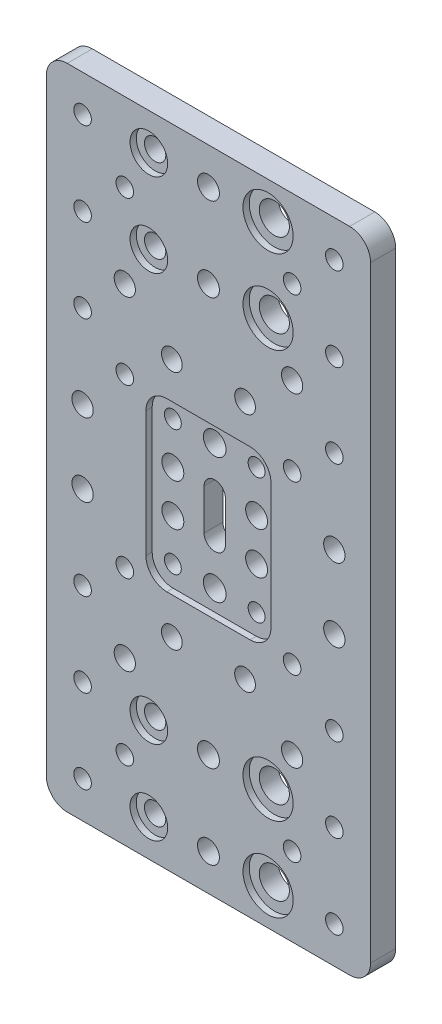
from build123d import *

# Parameters (mm, degrees)
BOSS_EXTRUDE1_OUTLINE_R    = 2.55
BOSS_EXTRUDE1_OUTLINE_R_2  = 2.621431339
BOSS_EXTRUDE1_OUTLINE_R_3  = 2.017902989
BOSS_EXTRUDE1_OUTLINE_R_4  = 2.1
BOSS_EXTRUDE1_OUTLINE_R_5  = 2.538142432
BOSS_EXTRUDE1_OUTLINE_R_6  = 2.478866387
BOSS_EXTRUDE1_OUTLINE_R_7  = 2.709196321
BOSS_EXTRUDE1_OUTLINE_R_8  = 2.625839509
BOSS_EXTRUDE1_OUTLINE_R_9  = 3.6
BOSS_EXTRUDE1_OUTLINE_R_10 = 2.614760952
BOSS_EXTRUDE1_DEPTH        = 6
SKETCH2_R                  = 6
SKETCH2_R_2                = 4.5
CUT_EXTRUDE1_DEPTH         = 1.5


# Read off the part's stored shape, not the designer's step: Boss-Extrude1
with BuildPart() as part:
    # Boss-Extrude1 outline → Boss-Extrude1 (new body)
    with BuildSketch(Plane.XY):
        with BuildLine():
            Line((-2.55, 0), (-2.55, 4.870526086))
            ThreePointArc((-2.55, 4.870526086), (0, 7.420526086), (2.55, 4.870526086))
            Line((2.55, 4.870526086), (2.55, 0))
            Line((2.55, 0), (38.76, 0))
            Line((38.76, 0), (38.76, 72.51))
            ThreePointArc((38.76, 72.51), (37.295533906, 76.045533906), (33.76, 77.51))
            Line((33.76, 77.51), (-33.76, 77.51))
            ThreePointArc((-33.76, 77.51), (-37.295533906, 76.045533906), (-38.76, 72.51))
            Line((-38.76, 72.51), (-38.76, 0))
            Line((-38.76, 0), (-2.55, 0))
        make_face()
        with Locations((-30.09, 8.75)):
            Circle(BOSS_EXTRUDE1_OUTLINE_R, mode=Mode.SUBTRACT)
        with Locations((-10.01, 5.02)):
            Circle(BOSS_EXTRUDE1_OUTLINE_R_2, mode=Mode.SUBTRACT)
        with Locations((-10.01, 15.02)):
            Circle(BOSS_EXTRUDE1_OUTLINE_R_3, mode=Mode.SUBTRACT)
        with Locations((-30.09, 28.75)):
            Circle(BOSS_EXTRUDE1_OUTLINE_R_4, mode=Mode.SUBTRACT)
        with Locations((-20, 20)):
            Circle(BOSS_EXTRUDE1_OUTLINE_R_4, mode=Mode.SUBTRACT)
        with Locations((-20, 38.75)):
            Circle(BOSS_EXTRUDE1_OUTLINE_R_5, mode=Mode.SUBTRACT)
        with Locations((-8.75, 28.75)):
            Circle(BOSS_EXTRUDE1_OUTLINE_R_6, mode=Mode.SUBTRACT)
        with Locations((10.01, 5.02)):
            Circle(BOSS_EXTRUDE1_OUTLINE_R_2, mode=Mode.SUBTRACT)
        with Locations((0, 15.02)):
            Circle(BOSS_EXTRUDE1_OUTLINE_R_7, mode=Mode.SUBTRACT)
        with Locations((10.01, 15.02)):
            Circle(BOSS_EXTRUDE1_OUTLINE_R_3, mode=Mode.SUBTRACT)
        with Locations((30.09, 8.75)):
            Circle(BOSS_EXTRUDE1_OUTLINE_R, mode=Mode.SUBTRACT)
        with Locations((8.75, 28.75)):
            Circle(BOSS_EXTRUDE1_OUTLINE_R_6, mode=Mode.SUBTRACT)
        with Locations((20, 20)):
            Circle(BOSS_EXTRUDE1_OUTLINE_R_4, mode=Mode.SUBTRACT)
        with Locations((30.09, 28.75)):
            Circle(BOSS_EXTRUDE1_OUTLINE_R_4, mode=Mode.SUBTRACT)
        with Locations((20, 38.75)):
            Circle(BOSS_EXTRUDE1_OUTLINE_R_5, mode=Mode.SUBTRACT)
        with Locations((-30.09, 48.75)):
            Circle(BOSS_EXTRUDE1_OUTLINE_R_4, mode=Mode.SUBTRACT)
        with Locations((-14.25, 48.75)):
            Circle(BOSS_EXTRUDE1_OUTLINE_R, mode=Mode.SUBTRACT)
        with Locations((-20, 58.76)):
            Circle(BOSS_EXTRUDE1_OUTLINE_R_4, mode=Mode.SUBTRACT)
        with Locations((-30.09, 68.75)):
            Circle(BOSS_EXTRUDE1_OUTLINE_R_4, mode=Mode.SUBTRACT)
        with Locations((-14.25, 68.75)):
            Circle(BOSS_EXTRUDE1_OUTLINE_R, mode=Mode.SUBTRACT)
        with Locations((0, 48.75)):
            Circle(BOSS_EXTRUDE1_OUTLINE_R_8, mode=Mode.SUBTRACT)
        with Locations((14.25, 48.75)):
            Circle(BOSS_EXTRUDE1_OUTLINE_R_9, mode=Mode.SUBTRACT)
        with Locations((30.09, 48.75)):
            Circle(BOSS_EXTRUDE1_OUTLINE_R_4, mode=Mode.SUBTRACT)
        with Locations((0, 68.75)):
            Circle(BOSS_EXTRUDE1_OUTLINE_R_10, mode=Mode.SUBTRACT)
        with Locations((14.25, 68.75)):
            Circle(BOSS_EXTRUDE1_OUTLINE_R_9, mode=Mode.SUBTRACT)
        with Locations((20, 58.76)):
            Circle(BOSS_EXTRUDE1_OUTLINE_R_4, mode=Mode.SUBTRACT)
        with Locations((30.09, 68.75)):
            Circle(BOSS_EXTRUDE1_OUTLINE_R_4, mode=Mode.SUBTRACT)
    extrude(amount=BOSS_EXTRUDE1_DEPTH)

    # Sketch2 → Cut-Extrude1 (cut)
    with BuildSketch(Plane.XY.offset(6)):
        with Locations((14.25, 68.75)):
            Circle(SKETCH2_R)
        with Locations((14.25, 48.75)):
            Circle(SKETCH2_R)
        with Locations((-14.25, 48.75)):
            Circle(SKETCH2_R_2)
        with Locations((-14.25, 68.75)):
            Circle(SKETCH2_R_2)
        with BuildLine():
            Line((9.95, -20), (-9.95, -20))
            ThreePointArc((-9.95, -20), (-13.485533906, -18.535533906), (-14.95, -15))
            Line((-14.95, -15), (-14.95, 15))
            ThreePointArc((-14.95, 15), (-13.485533906, 18.535533906), (-9.95, 20))
            Line((-9.95, 20), (9.95, 20))
            ThreePointArc((9.95, 20), (13.485533906, 18.535533906), (14.95, 15))
            Line((14.95, 15), (14.95, -15))
            ThreePointArc((14.95, -15), (13.485533906, -18.535533906), (9.95, -20))
        make_face()
    extrude(amount=-CUT_EXTRUDE1_DEPTH, mode=Mode.SUBTRACT)

    # Mirror1: part across plane


with BuildPart() as part_1:
    add(part.part)
    add(part.part.mirror(Plane(origin=(0, 0, 6), x_dir=(0, 0, 1), z_dir=(0, 1, 0))))


solid = part_1.part
